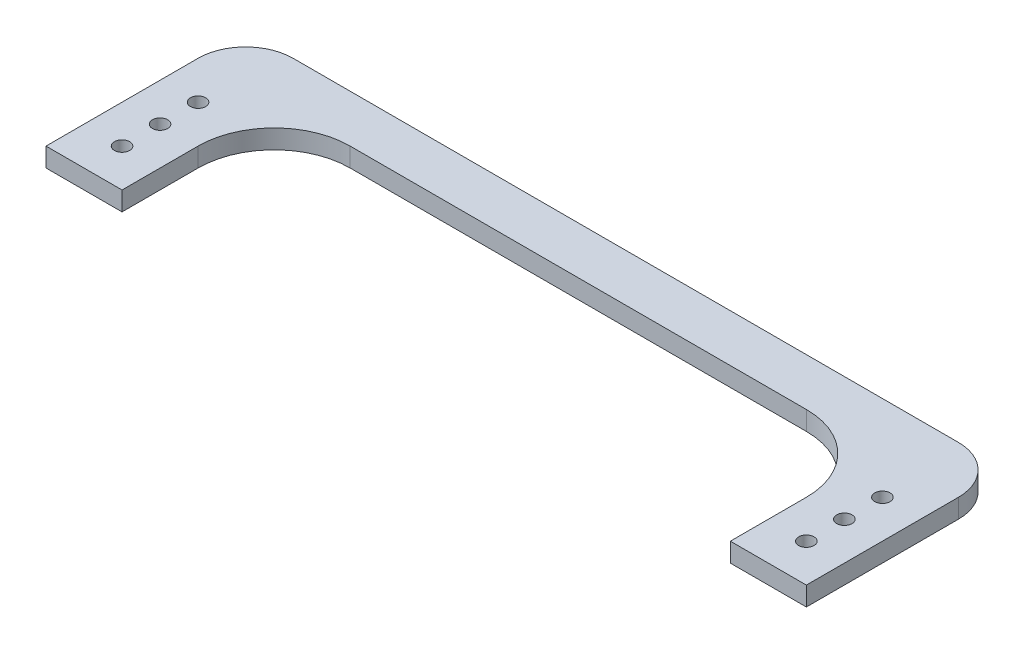
from build123d import *

# Parameters (mm, degrees)
BOSS_EXTRUDE1_DEPTH    = 6.35
F_10_CLEARANCE_HOLE1_D = 5.1054


with BuildPart() as part:
    # Sketch1 → Boss-Extrude1 (new body)
    with BuildSketch(Plane(origin=(0, 0, 0), x_dir=(1, 0, 0), z_dir=(0, 1, 0))):
        with BuildLine():
            Line((-101.6, -25.4), (-101.6, 0))
            ThreePointArc((-101.6, 0), (-94.160512242, 17.960512242), (-76.2, 25.4))
            Line((-76.2, 25.4), (76.2, 25.4))
            ThreePointArc((76.2, 25.4), (94.160512242, 17.960512242), (101.6, 0))
            Line((101.6, 0), (101.6, -25.4))
            Line((101.6, -25.4), (127, -25.4))
            Line((127, -25.4), (127, 25.4))
            ThreePointArc((127, 25.4), (122.350320151, 36.625320151), (111.125, 41.275))
            Line((111.125, 41.275), (-111.125, 41.275))
            ThreePointArc((-111.125, 41.275), (-122.350320151, 36.625320151), (-127, 25.4))
            Line((-127, 25.4), (-127, -25.4))
            Line((-127, -25.4), (-101.6, -25.4))
        make_face()
    extrude(amount=BOSS_EXTRUDE1_DEPTH)

    # #10 Clearance Hole1 (through all)
    with Locations(Plane(origin=(0, 6.35, 0), x_dir=(1, 0, 0), z_dir=(0, 1, 0))):
        with Locations((-114.3, -12.7), (-114.3, 0), (-114.3, 12.7), (114.3, 12.7), (114.3, 0), (114.3, -12.7)):
            Hole(F_10_CLEARANCE_HOLE1_D / 2)


solid = part.part
